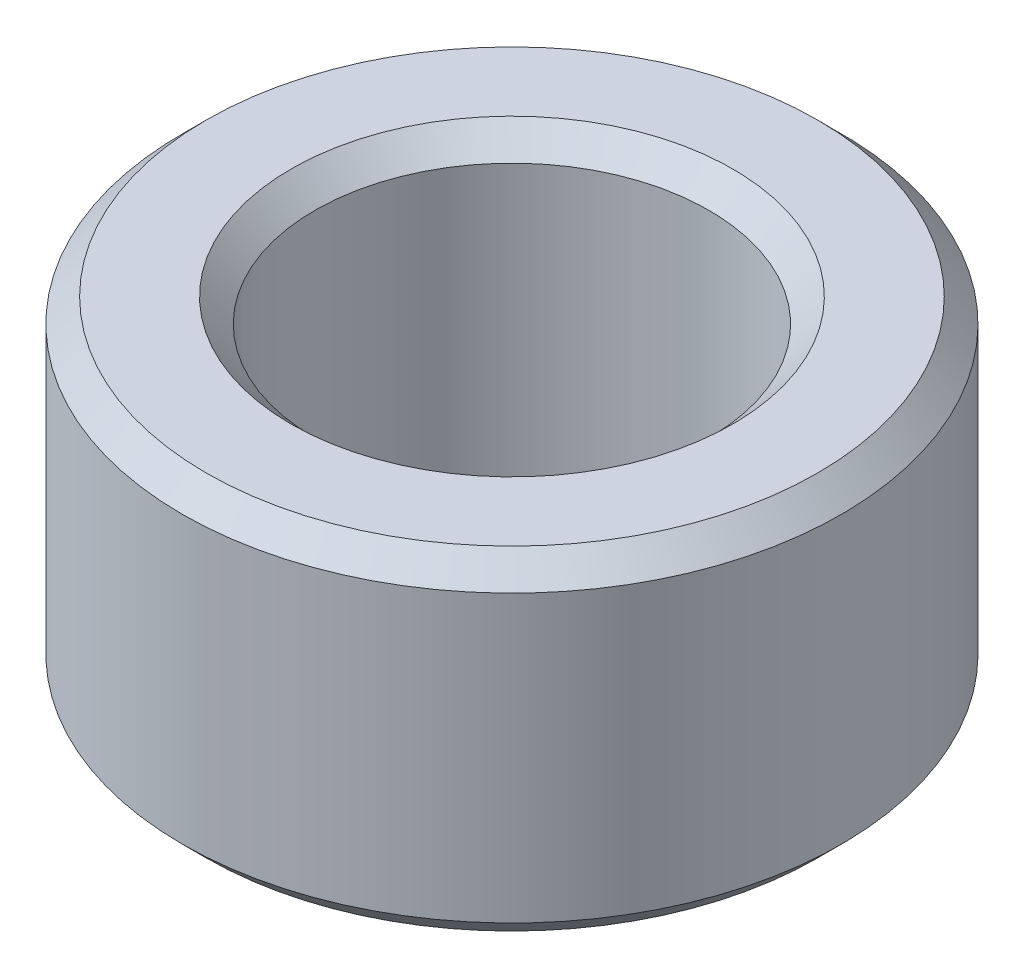
from build123d import *

# Parameters (mm, degrees)
SKETCH1_R           = 42.5
BOSS_EXTRUDE1_DEPTH = 42.991649664
SKETCH2_R           = 25.411577956
CUT_EXTRUDE1_DEPTH  = 74.897103738
CHAMFER1_SIZE       = 3.076811252


with BuildPart() as part:
    # Sketch1 → Boss-Extrude1 (new body)
    with BuildSketch(Plane(origin=(0, 0, 0), x_dir=(1, 0, 0), z_dir=(0, 1, 0))):
        Circle(SKETCH1_R)
    extrude(amount=BOSS_EXTRUDE1_DEPTH)

    # Sketch2 → Cut-Extrude1 (cut, through all)
    with BuildSketch(Plane(origin=(0, 0, 0), x_dir=(1, 0, 0), z_dir=(0, 1, 0))):
        Circle(SKETCH2_R)
    extrude(amount=CUT_EXTRUDE1_DEPTH, mode=Mode.SUBTRACT)

    # Chamfer1
    chamfer1_edges = [part.edges().sort_by_distance(p)[0] for p in [
        (-25.411577956, 42.991649664, 0),
        (-25.411577956, 0, 0),
        (-42.5, 0, 0),
        (-42.5, 42.991649664, 0),
    ]]
    chamfer(chamfer1_edges, length=CHAMFER1_SIZE)


solid = part.part
